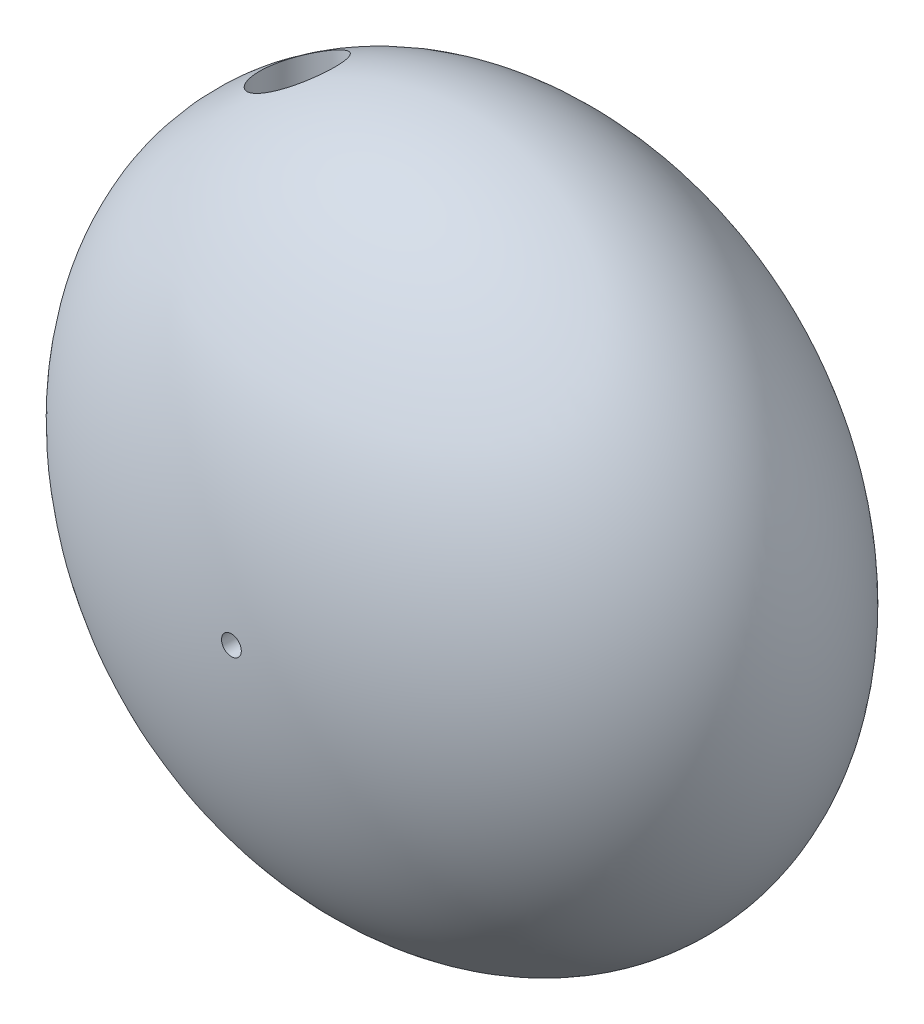
from build123d import *

# Parameters (mm, degrees)
CUT_EXTRUDE2_DEPTH      = 42.041138069
CUT_EXTRUDE2_DEPTH_BACK = 42.041138069
SKETCH4_R               = 0.75
CUT_EXTRUDE3_START      = -27
CUT_EXTRUDE3_OUTLINE_R  = 1.1
CUT_EXTRUDE3_DEPTH      = 27.0001
SKETCH6_R               = 2.05
CUT_EXTRUDE4_DEPTH      = 10
SKETCH6_5_R             = 2.05
CUT_EXTRUDE10_DEPTH     = 10
CUT_EXTRUDE8_REACH      = 43.038
SKETCH6_4_R             = 1.6
CUT_EXTRUDE11_REACH     = 43.038
SKETCH6_6_R             = 1.6
CUT_EXTRUDE9_REACH      = 61.038
CUT_EXTRUDE9_START      = -18
SKETCH11_R              = 2.85
CUT_EXTRUDE12_REACH     = 61.038
CUT_EXTRUDE12_START     = 18
SKETCH11_3_R            = 2.85
SKETCH12_R              = 2.05
CUT_EXTRUDE13_DEPTH     = 8
CHAMFER1_SIZE           = 1.5


with BuildPart() as part:
    # Sketch1 → Revolve4 (revolve)
    with BuildSketch(Plane(origin=(0, 0, 0), x_dir=(1, 0, 0), z_dir=(0, 1, 0))):
        with BuildLine():
            Line((0, 17.5), (0, -17.5))
            add(Edge.make_bspline(
                [(0, -17.5), (26.25, -17.5), (26.25, 0), (26.25, 17.5), (0, 17.5)],
                knots=[1.570796327, 1.570796327, 1.570796327, 3.141592654, 3.141592654, 4.71238898, 4.71238898, 4.71238898], degree=2, weights=[1, 0.707106781, 1, 0.707106781, 1]))
        make_face()
    revolve(axis=Axis((0, 0, -17.5), (0, 0, 1)))

    # Sketch4 → Cut-Extrude2 (cut, two sides: drawn at the far end of the back side and taken through both)
    with BuildSketch(Plane.XY.offset(-CUT_EXTRUDE2_DEPTH_BACK)):
        with Locations(Location((0, 0, 0), (0, 0, 180))):
            Circle(SKETCH4_R)
    extrude(amount=CUT_EXTRUDE2_DEPTH + CUT_EXTRUDE2_DEPTH_BACK, mode=Mode.SUBTRACT)

    # Cut-Extrude3: read off the stored shape, not the designer's step
    # Cut-Extrude3 outline → Cut-Extrude3 (cut)
    with BuildSketch(Plane(origin=(0, 0, 0), x_dir=(1, 0, 0), z_dir=(0, 1, 0)).offset(CUT_EXTRUDE3_START)):
        Circle(CUT_EXTRUDE3_OUTLINE_R)
    extrude(amount=CUT_EXTRUDE3_DEPTH, mode=Mode.SUBTRACT)

    # Sketch6 → Cut-Extrude4 (cut)
    with BuildSketch(Plane(origin=(0, 0, 0), x_dir=(1, 0, 0), z_dir=(0, 1, 0))):
        with Locations(Location((-12.5, 0, 0), (0, 0, 270))):
            Circle(SKETCH6_R)
    extrude(amount=-CUT_EXTRUDE4_DEPTH, mode=Mode.SUBTRACT)

    # Sketch6<5> → Cut-Extrude10 (cut)
    with BuildSketch(Plane(origin=(0, 0, 0), x_dir=(1, 0, 0), z_dir=(0, 1, 0))):
        with Locations(Location((12.5, 0, 0), (0, 0, 270))):
            Circle(SKETCH6_5_R)
    extrude(amount=CUT_EXTRUDE10_DEPTH, mode=Mode.SUBTRACT)

    # Sketch6<4> → Cut-Extrude8 (cut, up to next)
    with BuildSketch(Plane(origin=(0, 0, 0), x_dir=(1, 0, 0), z_dir=(0, 1, 0)), mode=Mode.PRIVATE) as cut_extrude8_sk1:
        with Locations(Location((12.5, 0, 0), (0, 0, 270))):
            Circle(SKETCH6_4_R)
    cut_extrude8_tool1 = extrude(cut_extrude8_sk1.sketch, amount=-CUT_EXTRUDE8_REACH, mode=Mode.PRIVATE) & part.part
    add(cut_extrude8_tool1.solids().sort_by_distance((12.5, 0, 0))[0], mode=Mode.SUBTRACT)

    # Sketch6<6> → Cut-Extrude11 (cut, up to next)
    with BuildSketch(Plane(origin=(0, 0, 0), x_dir=(1, 0, 0), z_dir=(0, 1, 0)), mode=Mode.PRIVATE) as cut_extrude11_sk1:
        with Locations(Location((-12.5, 0, 0), (0, 0, 90))):
            Circle(SKETCH6_6_R)
    cut_extrude11_tool1 = extrude(cut_extrude11_sk1.sketch, amount=CUT_EXTRUDE11_REACH, mode=Mode.PRIVATE) & part.part
    add(cut_extrude11_tool1.solids().sort_by_distance((-12.5, 0, 0))[0], mode=Mode.SUBTRACT)

    # Sketch11 → Cut-Extrude9 (cut, up to next)
    with BuildSketch(Plane(origin=(0, 0, 0), x_dir=(1, 0, 0), z_dir=(0, 1, 0)).offset(CUT_EXTRUDE9_START), mode=Mode.PRIVATE) as cut_extrude9_sk1:
        with Locations(Location((12.5, 0, 0), (0, 0, 270))):
            Circle(SKETCH11_R)
    cut_extrude9_tool1 = extrude(cut_extrude9_sk1.sketch, amount=-CUT_EXTRUDE9_REACH, mode=Mode.PRIVATE) & part.part
    add(cut_extrude9_tool1.solids().sort_by_distance((12.5, -18, 0))[0], mode=Mode.SUBTRACT)

    # Sketch11<3> → Cut-Extrude12 (cut, up to next)
    with BuildSketch(Plane(origin=(0, 0, 0), x_dir=(1, 0, 0), z_dir=(0, 1, 0)).offset(CUT_EXTRUDE12_START), mode=Mode.PRIVATE) as cut_extrude12_sk1:
        with Locations(Location((-12.5, 0, 0), (0, 0, 90))):
            Circle(SKETCH11_3_R)
    cut_extrude12_tool1 = extrude(cut_extrude12_sk1.sketch, amount=CUT_EXTRUDE12_REACH, mode=Mode.PRIVATE) & part.part
    add(cut_extrude12_tool1.solids().sort_by_distance((-12.5, 18, 0))[0], mode=Mode.SUBTRACT)

    # Sketch12 → Cut-Extrude13 (cut)
    with BuildSketch(Plane(origin=(0, 0, 0), x_dir=(1, 0, 0), z_dir=(0, 1, 0))):
        with Locations(Location((0, 0, 0), (0, 0, 270))):
            Circle(SKETCH12_R)
    extrude(amount=-CUT_EXTRUDE13_DEPTH, mode=Mode.SUBTRACT)

    # Chamfer1
    # the kernel refuses this chamfer: 1.5 mm, written as the material it adds along each edge
    with BuildSketch(Plane(origin=(0, -8, 0), x_dir=(0, 0, 1), z_dir=(-1, 0, 0))) as chamfer1_piece_1_section:
        Polygon((2.05 - CHAMFER1_SIZE, 0), (2.05, CHAMFER1_SIZE), (2.05, 0), align=None)
    chamfer1_piece_1 = revolve(axis=Axis((0, -8, 0), (0, 1, 0)), mode=Mode.PRIVATE)
    chamfer1_piece_1 = chamfer1_piece_1 - Plane(origin=(0, -8, 0), x_dir=(1, 0, 0), z_dir=(0, -1, 0)) * Cylinder(1.1, 9, mode=Mode.PRIVATE)
    add(chamfer1_piece_1)


solid = part.part
